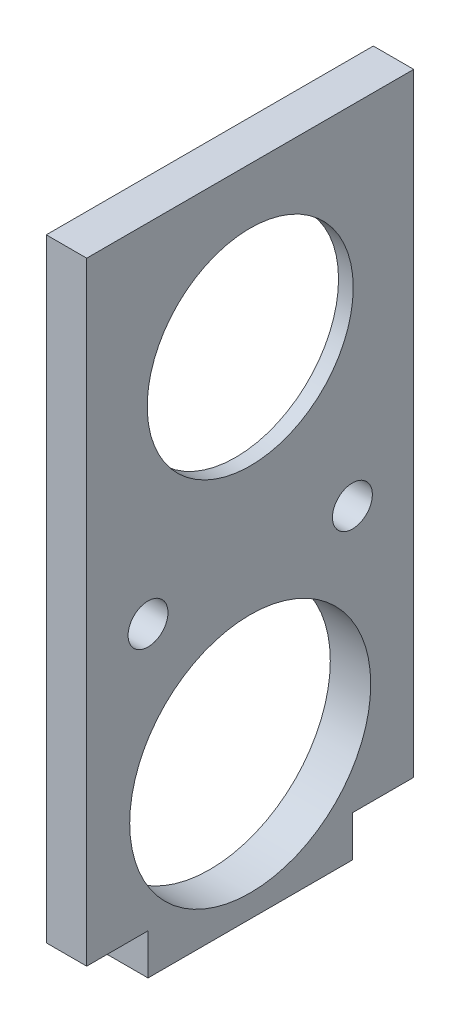
from build123d import *

# Parameters (mm, degrees)
SKETCH1_W               = 3.14
SKETCH1_H               = 50.8
EXTRUDE1_DEPTH          = 25.4
CUT_EXTRUDE1_DEPTH      = 36.955318105
CUT_EXTRUDE1_DEPTH_BACK = 36.955318105
SKETCH2_R               = 9.36
SKETCH2_R_2             = 8
SKETCH2_R_3             = 1.55
SKETCH2_W               = 4.7625
SKETCH2_H               = 3.175
SKETCH3_R               = 11
CUT_EXTRUDE2_DEPTH      = 2


with BuildPart() as part:
    # Sketch1 → Extrude1 (new body)
    with BuildSketch(Plane.XY):
        Rectangle(SKETCH1_W, SKETCH1_H)
    extrude(amount=EXTRUDE1_DEPTH)

    # Sketch2 → Cut-Extrude1 (cut, two sides: drawn at the far end of the back side and taken through both)
    with BuildSketch(Plane(origin=(0, 0, 0), x_dir=(0, 0, -1), z_dir=(1, 0, 0)).offset(-CUT_EXTRUDE1_DEPTH_BACK)):
        with Locations((-12.7, -14.2875)):
            Circle(SKETCH2_R)
        with Locations((-12.7, 13.0725)):
            Circle(SKETCH2_R_2)
        with Locations((-20.6375, -1.5875)):
            Circle(SKETCH2_R_3)
        with Locations((-4.7625, -1.5875)):
            Circle(SKETCH2_R_3)
        with Locations((-23.01875, -23.8125)):
            Rectangle(SKETCH2_W, SKETCH2_H)
        with Locations((-2.38125, -23.8125)):
            Rectangle(SKETCH2_W, SKETCH2_H)
    extrude(amount=CUT_EXTRUDE1_DEPTH + CUT_EXTRUDE1_DEPTH_BACK, mode=Mode.SUBTRACT)

    # Sketch3 → Cut-Extrude2 (cut)
    with BuildSketch(Plane.ZY.offset(1.57)):
        with Locations((12.7, 13.0725)):
            Circle(SKETCH3_R)
    extrude(amount=-CUT_EXTRUDE2_DEPTH, mode=Mode.SUBTRACT)


solid = part.part
